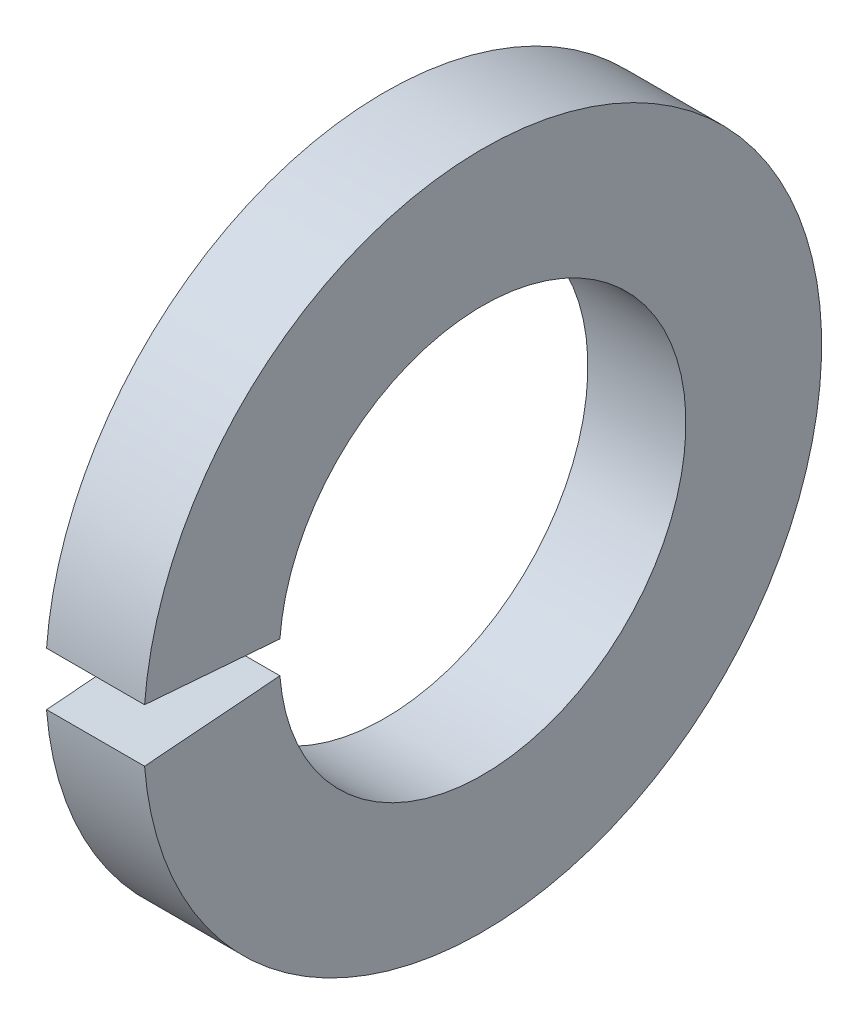
from build123d import *

# Parameters (mm, degrees)
SKETCH1_W = 3.9624
SKETCH1_H = 5.4864
GAP_DEPTH = 20.780330522


with BuildPart() as part:
    # Sketch1 → Base-Revolve (revolve)
    with BuildSketch(Plane.XY):
        with Locations((-1.9812, 10.9601)):
            Rectangle(SKETCH1_W, SKETCH1_H)
    revolve(axis=Axis((-34.925, 0, 0), (1, 0, 0)))

    # Sketch2 → Gap (cut, through all)
    with BuildSketch(Plane(origin=(0, 0, 0), x_dir=(0, -1, 0), z_dir=(-1, 0, 0))):
        with BuildLine():
            Line((0, 0), (1.096651497, 13.934278445))
            ThreePointArc((1.096651497, 13.934278445), (0, 13.977366), (-1.096651497, 13.934278445))
            Line((-1.096651497, 13.934278445), (0, 0))
        make_face()
    extrude(amount=GAP_DEPTH, mode=Mode.SUBTRACT)


solid = part.part
